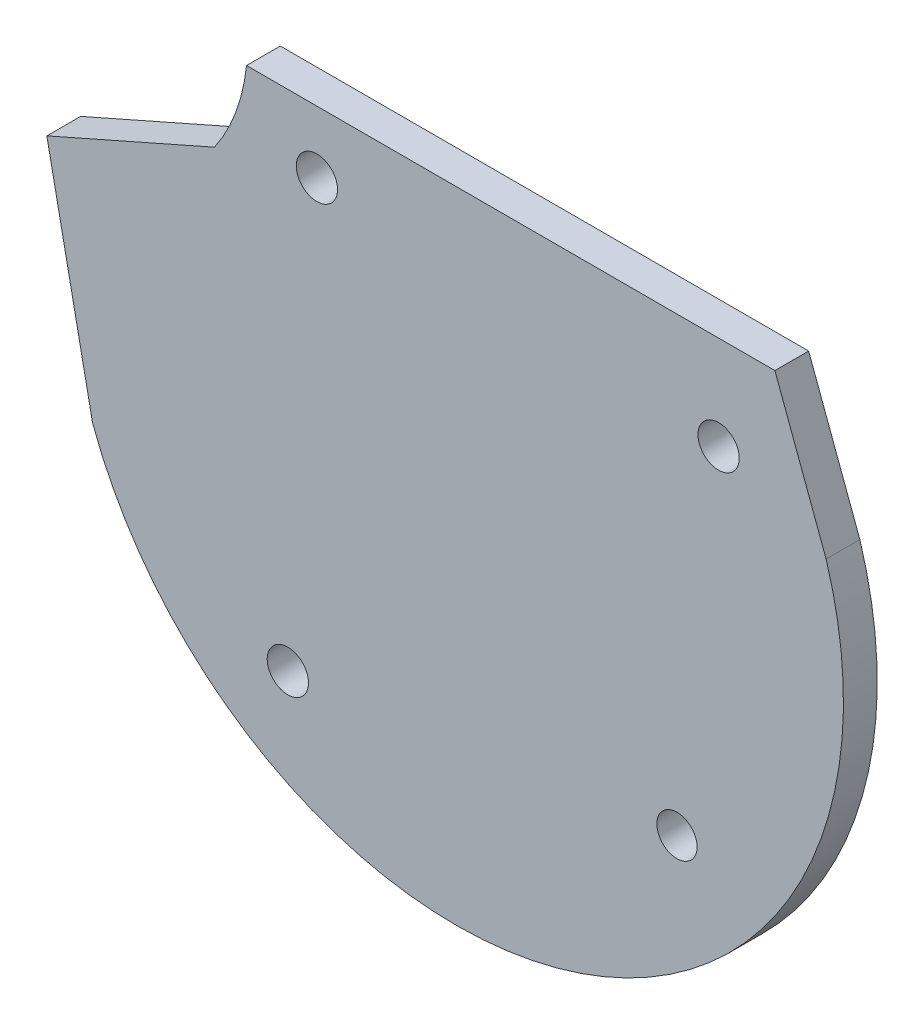
from build123d import *

# Parameters (mm, degrees)
SKETCH5_R      = 1.397
SKETCH5_R_2    = 1.362219034
EXTRUDE1_DEPTH = 2.286


with BuildPart() as part:
    # Sketch5 → Extrude1 (new body)
    with BuildSketch(Plane(origin=(0, 0, 0), x_dir=(-0.01837554274113891, 0.999831155460245, 0), z_dir=(0, 0, -1))):
        with BuildLine():
            Line((33.80665155, 26.18621859), (34.46394605, -9.577814671))
            ThreePointArc((34.46394605, -9.577814671), (31.404055355, -10.348947358), (28.630167887, -11.853315998))
            Line((28.630167887, -11.853315998), (23.830153765, -23.292701447))
            Line((23.830153765, -23.292701447), (8.486225874, -20.477486777))
            ThreePointArc((8.486225874, -20.477486777), (-7.865336256, 12.262044577), (24.425706506, 29.482353943))
            Line((24.425706506, 29.482353943), (33.80665155, 26.18621859))
        make_face()
        with Locations((27.527734531, 22.260177192)):
            Circle(SKETCH5_R, mode=Mode.SUBTRACT)
        with Locations((30.179746314, -4.890797216)):
            Circle(SKETCH5_R, mode=Mode.SUBTRACT)
        with Locations((3.363138785, 18.996048152)):
            Circle(SKETCH5_R_2, mode=Mode.SUBTRACT)
        with Locations((0.317842079, -7.407837933)):
            Circle(SKETCH5_R, mode=Mode.SUBTRACT)
    extrude(amount=EXTRUDE1_DEPTH)


solid = part.part
